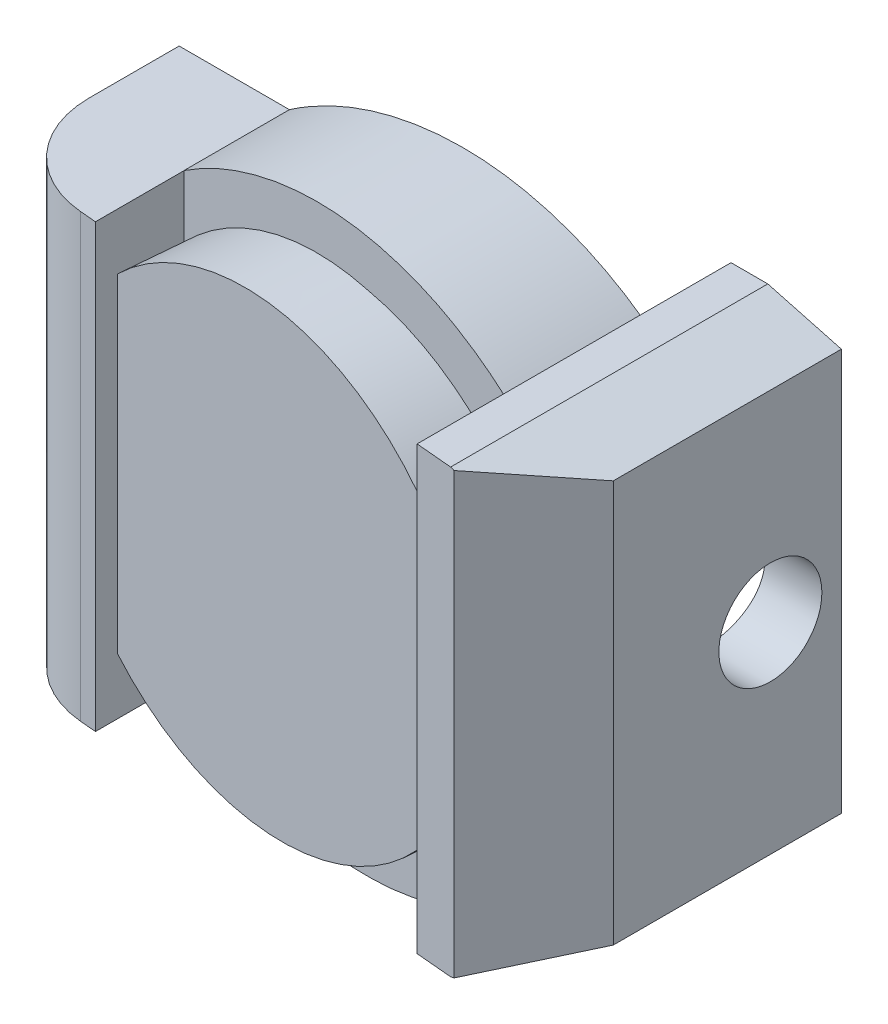
from build123d import *
from OCP.BRepFilletAPI import BRepFilletAPI_MakeChamfer

# Parameters (mm, degrees)
SKETCH1_W                         = 3.81
SKETCH1_H                         = 15.24
BOSS_EXTRUDE1_DEPTH               = 8.128
BOSS_EXTRUDE1_2_DEPTH             = 8.128
CUT_EXTRUDE2_DEPTH                = 20.911072799
SKETCH12_R                        = 7.9375
MAGNET_DEPTH                      = 4.572
BOSS_EXTRUDE6_DEPTH               = 3.048
SKETCH14_R                        = 1.778
CUT_EXTRUDE4_DEPTH                = 2.54
CHAMFER3_SIZE                     = 2.54
CHAMFER3_SIZE2                    = 0.680590949
CHAMFER4_SIZE                     = 2.54
CHAMFER4_SIZE2                    = 0.680590949
CHAMFER5_SIZE                     = 3.302
CHAMFER5_SIZE2                    = 2.421231652
BOSS_EXTRUDE7_REACH               = 20.006
BOSS_EXTRUDE7_OFFSET_FROM_SURFACE = 3.048
FILLET1_R                         = 3.556


with BuildPart() as part:
    # Sketch1 → Boss-Extrude1 (new body)
    with BuildSketch(Plane.XY):
        with Locations((-8.001, 0)):
            Rectangle(SKETCH1_W, SKETCH1_H)
    extrude(amount=BOSS_EXTRUDE1_DEPTH)


with BuildPart() as body_2:
    # Sketch1 → Boss-Extrude1 2 (new body)
    with BuildSketch(Plane.XY):
        with Locations((8.001, 0)):
            Rectangle(SKETCH1_W, SKETCH1_H)
    extrude(amount=BOSS_EXTRUDE1_2_DEPTH)


with BuildPart() as cut_extrude2_tool:
    # Sketch6 → Cut-Extrude2 (new, through all)
    with BuildSketch(Plane(origin=(0, 7.62, 0), x_dir=(1, 0, 0), z_dir=(0, 1, 0))):
        Polygon((-9.906, -6.359826106), (9.906, -8.128), (-9.906, -8.128), align=None)
    extrude(amount=-CUT_EXTRUDE2_DEPTH)


with BuildPart() as part_1:
    add(part.part)

    # Cut-Extrude2: cut by cut_extrude2_tool
    add(cut_extrude2_tool.part, mode=Mode.SUBTRACT)

    # Cut-Loft1: read off the stored shape, not the designer's step
    # Cut-Loft1: loft between two sections, ruled curve by curve
    cut_loft1_from = [
        Edge.make_bspline([(-0.341139785, 7.934039191, 6.44843844), (15.401545931, 7.465303163, 7.853435709), (14.936513948, -8.402775219, 7.811932711), (-0.806171769, -7.934039191, 6.406935441), (-16.548857485, -7.465303163, 5.001938171), (-16.083825501, 8.402775219, 5.04344117), (-0.341139785, 7.934039191, 6.44843844)], [0, 0, 0, 0, 0.5, 0.5, 0.5, 1, 1, 1, 1], 3, [1, 0.333333333, 0.333333333, 1, 0.333333333, 0.333333333, 1]),
    ]
    cut_loft1_to = [
        Edge.make_bspline([(-0.164568393, 7.935793816, 0), (15.70701924, 8.264930602, 0), (16.036156025, -7.606657031, 0), (0.164568393, -7.935793816, 0), (-15.70701924, -8.264930602, 0), (-16.036156025, 7.606657031, 0), (-0.164568393, 7.935793816, 0)], [0, 0, 0, 0, 0.5, 0.5, 0.5, 1, 1, 1, 1], 3, [1, 0.333333333, 0.333333333, 1, 0.333333333, 0.333333333, 1]),
    ]
    cut_loft1 = Solid(Shell([*[Face.make_surface_from_curves(cut_loft1_from[k], cut_loft1_to[k]) for k in range(1)], Face(Wire(cut_loft1_from)), Face(Wire(cut_loft1_to))]))
    add(cut_loft1, mode=Mode.SUBTRACT)


with BuildPart() as body_2_1:
    add(body_2.part)

    # Cut-Extrude2: cut by cut_extrude2_tool
    add(cut_extrude2_tool.part, mode=Mode.SUBTRACT)

    # Cut-Loft1 2: loft between two sections, ruled curve by curve
    cut_loft1_2_from = [
        Edge.make_bspline([(-0.341139785, 7.934039191, 6.44843844), (15.401545931, 7.465303163, 7.853435709), (14.936513948, -8.402775219, 7.811932711), (-0.806171769, -7.934039191, 6.406935441), (-16.548857485, -7.465303163, 5.001938171), (-16.083825501, 8.402775219, 5.04344117), (-0.341139785, 7.934039191, 6.44843844)], [0, 0, 0, 0, 0.5, 0.5, 0.5, 1, 1, 1, 1], 3, [1, 0.333333333, 0.333333333, 1, 0.333333333, 0.333333333, 1]),
    ]
    cut_loft1_2_to = [
        Edge.make_bspline([(-0.164568393, 7.935793816, 0), (15.70701924, 8.264930602, 0), (16.036156025, -7.606657031, 0), (0.164568393, -7.935793816, 0), (-15.70701924, -8.264930602, 0), (-16.036156025, 7.606657031, 0), (-0.164568393, 7.935793816, 0)], [0, 0, 0, 0, 0.5, 0.5, 0.5, 1, 1, 1, 1], 3, [1, 0.333333333, 0.333333333, 1, 0.333333333, 0.333333333, 1]),
    ]
    cut_loft1_2 = Solid(Shell([*[Face.make_surface_from_curves(cut_loft1_2_from[k], cut_loft1_2_to[k]) for k in range(1)], Face(Wire(cut_loft1_2_from)), Face(Wire(cut_loft1_2_to))]))
    add(cut_loft1_2, mode=Mode.SUBTRACT)


with BuildPart() as body_3:
    # Sketch12 → Magnet (new body)
    with BuildSketch(Plane(origin=(-0.573655777, 0, 6.42768694), x_dir=(-0.9960410654107703, 0, -0.08889429686643446), z_dir=(0.08889429686643446, 0, -0.9960410654107703))):
        Circle(SKETCH12_R)
    extrude(amount=MAGNET_DEPTH)


with BuildPart() as body_4:
    # Sketch13 → Boss-Extrude6 (new body)
    with BuildSketch(Plane(origin=(0, 0, 0), x_dir=(-1, 0, 0), z_dir=(0, 0, -1))):
        with BuildLine():
            Line((-6.096, 5.08357062), (-6.096, 7.62))
            Line((-6.096, 7.62), (-9.906, 7.62))
            Line((-9.906, 7.62), (-9.906, -7.62))
            Line((-9.906, -7.62), (-6.096, -7.62))
            Line((-6.096, -7.62), (-6.096, -5.08357062))
            ThreePointArc((-6.096, -5.08357062), (-7.9375, 0), (-6.096, 5.08357062))
        make_face()
    extrude(amount=BOSS_EXTRUDE6_DEPTH)


with BuildPart() as cut_extrude4_tool:
    # Sketch14 → Cut-Extrude4 (new body)
    with BuildSketch(Plane(origin=(9.906, 0, 0), x_dir=(0, 0, -1), z_dir=(1, 0, 0))):
        with Locations((0.597062067, -1.1e-08)):
            Circle(SKETCH14_R)
    extrude(amount=-CUT_EXTRUDE4_DEPTH)


with BuildPart() as body_2_2:
    add(body_2_1.part)

    # Cut-Extrude4: cut by cut_extrude4_tool
    add(cut_extrude4_tool.part, mode=Mode.SUBTRACT)

    # Chamfer3: one chamfer whose edges measure the first distance from different faces: ONE call of the kernel's chamfer builder (chamfer() names one face for all edges)
    chamfer3_edges_1 = [body_2_2.edges().sort_by_distance(p)[0] for p in [
        (9.906, -7.62, 4.064),
    ]]
    chamfer3_side_1 = [body_2_2.faces().sort_by_distance(p)[0] for p in [
        (8.014566329, -7.62, 3.979597021),
    ]]
    chamfer3_edges_2 = [body_2_2.edges().sort_by_distance(p)[0] for p in [
        (9.906, 7.62, 4.064),
    ]]
    chamfer3_side_2 = [body_2_2.faces().sort_by_distance(p)[0] for p in [
        (8.014566329, 7.62, 3.979597021),
    ]]
    chamfer3 = BRepFilletAPI_MakeChamfer(body_2_2.part.solid().wrapped)
    for e in chamfer3_edges_1:
        chamfer3.Add(CHAMFER3_SIZE, CHAMFER3_SIZE2, e.wrapped, chamfer3_side_1[0].wrapped)  # the first distance lies on this face
    for e in chamfer3_edges_2:
        chamfer3.Add(CHAMFER3_SIZE, CHAMFER3_SIZE2, e.wrapped, chamfer3_side_2[0].wrapped)  # the first distance lies on this face
    add(Compound.cast(chamfer3.Shape()), mode=Mode.REPLACE)

    # Chamfer5
    chamfer5_edges = [body_2_2.edges().sort_by_distance(p)[0] for p in [
        (9.906, 0, 8.128),
    ]]
    chamfer5_side = [body_2_2.faces().sort_by_distance(p)[0] for p in [
        (9.906, 0, 4.157766254),
    ]]
    chamfer(chamfer5_edges, length=CHAMFER5_SIZE, length2=CHAMFER5_SIZE2, reference=chamfer5_side[0])

    # Boss-Extrude7: up to this face of the body (flat: up to its plane, moved by the offset)
    boss_extrude7_end = Plane(body_2_2.part.faces().sort_by_distance((6.795040928, 0, 7.8503543))[0]).offset(-BOSS_EXTRUDE7_OFFSET_FROM_SURFACE)
    # Sketch15 → Boss-Extrude7 (add, up to the picked face)
    with BuildSketch(Plane.XY, mode=Mode.PRIVATE) as boss_extrude7_sk1:
        with BuildLine():
            Line((6.096, 5.08357062), (6.096, 7.471449808))
            add(Edge.make_bspline(
                [(6.096, 7.471449808), (5.930756217, 7.591123534), (5.255615528, 8.051037173), (3.293003266, 9.079390192), (1.283010021, 9.48240548), (-0.107834445, 9.483073279), (-1.498678912, 9.483741079), (-3.43762918, 9.094971238), (-5.325260948, 8.130204629), (-5.94396227, 7.728072028), (-6.096, 7.623571521)],
                knots=[0.900690867, 0.900690867, 0.900690867, 0.900690867, 0.909893147, 0.9375, 1, 1, 1, 1.0625, 1.087339124, 1.095618826, 1.095618826, 1.095618826, 1.095618826], degree=3))
            Line((-6.096, 7.623571521), (-6.096001081, 5.083571521))
            add(Edge.make_bspline(
                [(6.096, 5.08357062), (5.93161291, 5.274891544), (5.758408134, 5.458513784), (5.199745975, 5.997244915), (4.788453523, 6.323024277), (4.121406265, 6.751856672), (3.889862409, 6.885002693), (3.419802681, 7.125246454), (3.180186729, 7.23314886), (2.447832586, 7.520869047), (1.940077624, 7.665345536), (0.893913787, 7.852965093), (0.366394093, 7.894488776), (-0.165582558, 7.883517088), (-0.697559209, 7.8725454), (-1.219532269, 7.809382621), (-1.988103649, 7.639571774), (-2.241878196, 7.570363771), (-2.744485351, 7.406164502), (-2.993938175, 7.310744438), (-3.718584086, 6.991700252), (-4.175623921, 6.734186385), (-5.038069326, 6.130349805), (-5.444832888, 5.781030811), (-5.906820855, 5.29786321), (-6.002858614, 5.191954979), (-6.096001081, 5.083571521)],
                knots=[0.860122022, 0.860122022, 0.860122022, 0.860122022, 0.875, 0.875, 0.90625, 0.90625, 0.921875, 0.921875, 0.9375, 0.9375, 0.96875, 0.96875, 1, 1, 1, 1.03125, 1.03125, 1.046875, 1.046875, 1.0625, 1.0625, 1.09375, 1.09375, 1.125, 1.125, 1.133513625, 1.133513625, 1.133513625, 1.133513625], degree=3))
        make_face()
    boss_extrude7_tool1 = split(extrude(boss_extrude7_sk1.sketch, amount=BOSS_EXTRUDE7_REACH, mode=Mode.PRIVATE), bisect_by=boss_extrude7_end, keep=Keep.BOTH, mode=Mode.PRIVATE)
    # Sketch15 → Boss-Extrude7 (add, up to the picked face)
    with BuildSketch(Plane.XY, mode=Mode.PRIVATE) as boss_extrude7_sk2:
        with BuildLine():
            add(Edge.make_bspline(
                [(-6.096, -5.334665385), (-6.001608062, -5.440026559), (-5.904161756, -5.543205008), (-5.428535567, -6.020913198), (-5.021324344, -6.355746552), (-4.367831042, -6.794427859), (-4.142640685, -6.930176212), (-3.677224948, -7.180264747), (-3.435889004, -7.294952261), (-2.704038324, -7.599333248), (-2.202060233, -7.75220516), (-1.170288992, -7.959061026), (-0.636413301, -8.012110875), (0.415017809, -8.012485804), (0.937476738, -7.961532915), (1.716181401, -7.806841712), (1.975144289, -7.741886149), (2.479947756, -7.588440875), (2.974576658, -7.410991551), (3.449201256, -7.186347645), (3.913706318, -6.937829508), (4.141960005, -6.800903506), (4.803088275, -6.358194944), (5.208510395, -6.024190383), (5.760001551, -5.471897601), (5.932187446, -5.282339739), (6.096, -5.08357062)],
                knots=[1.366624359, 1.366624359, 1.366624359, 1.366624359, 1.375, 1.375, 1.40625, 1.40625, 1.421875, 1.421875, 1.4375, 1.4375, 1.46875, 1.46875, 1.5, 1.5, 1.53125, 1.53125, 1.546875, 1.546875, 1.5625, 1.578125, 1.578125, 1.59375, 1.59375, 1.625, 1.625, 1.640183323, 1.640183323, 1.640183323, 1.640183323], degree=3))
            Line((6.096, -5.08357062), (6.096, -7.72253105))
            add(Edge.make_bspline(
                [(-6.096, -7.874665385), (-5.811745982, -8.069955065), (-5.191368312, -8.452655749), (-3.271071363, -9.379610796), (-0.11139785, -10.010823197), (3.138794467, -9.363488053), (5.12304575, -8.377449625), (5.814796936, -7.926184012), (6.096, -7.72253105)],
                knots=[1.404521499, 1.404521499, 1.404521499, 1.404521499, 1.420146511, 1.4375, 1.5, 1.5625, 1.583974967, 1.599599961, 1.599599961, 1.599599961, 1.599599961], degree=3))
            Line((-6.096, -7.874665385), (-6.096, -5.334665385))
        make_face()
    boss_extrude7_tool2 = split(extrude(boss_extrude7_sk2.sketch, amount=BOSS_EXTRUDE7_REACH, mode=Mode.PRIVATE), bisect_by=boss_extrude7_end, keep=Keep.BOTH, mode=Mode.PRIVATE)

    add(part_1.part)  # Boss-Extrude7 merges part

    add(body_3.part)  # Boss-Extrude7 merges body 3


with BuildPart() as body_4_1:
    add(body_4.part)

    # Cut-Extrude4: cut by cut_extrude4_tool
    add(cut_extrude4_tool.part, mode=Mode.SUBTRACT)

    # Chamfer4: one chamfer whose edges measure the first distance from different faces: ONE call of the kernel's chamfer builder (chamfer() names one face for all edges)
    chamfer4_edges_1 = [body_4_1.edges().sort_by_distance(p)[0] for p in [
        (9.906, -7.62, -1.524),
    ]]
    chamfer4_side_1 = [body_4_1.faces().sort_by_distance(p)[0] for p in [
        (8.001, -7.62, -1.524),
    ]]
    chamfer4_edges_2 = [body_4_1.edges().sort_by_distance(p)[0] for p in [
        (9.906, 7.62, -1.524),
    ]]
    chamfer4_side_2 = [body_4_1.faces().sort_by_distance(p)[0] for p in [
        (8.001, 7.62, -1.524),
    ]]
    chamfer4 = BRepFilletAPI_MakeChamfer(body_4_1.part.solid().wrapped)
    for e in chamfer4_edges_1:
        chamfer4.Add(CHAMFER4_SIZE, CHAMFER4_SIZE2, e.wrapped, chamfer4_side_1[0].wrapped)  # the first distance lies on this face
    for e in chamfer4_edges_2:
        chamfer4.Add(CHAMFER4_SIZE, CHAMFER4_SIZE2, e.wrapped, chamfer4_side_2[0].wrapped)  # the first distance lies on this face
    add(Compound.cast(chamfer4.Shape()), mode=Mode.REPLACE)


with BuildPart() as body_2_3:
    add(body_2_2.part)

    add(body_4_1.part)  # Boss-Extrude7 merges body 4
    add(boss_extrude7_tool1.solids().sort_by(Axis((5.966385, 6.27751, 0), (0, 0, 1)))[0])
    add(boss_extrude7_tool2.solids().sort_by(Axis((0.034935, -8.049766, 0), (0, 0, 1)))[0])

    # Fillet1
    fillet1_edges = [body_2_3.edges().sort_by_distance(p)[0] for p in [
        (-9.906, 0, 6.359826106),
    ]]
    fillet(fillet1_edges, radius=FILLET1_R)


solid = body_2_3.part
